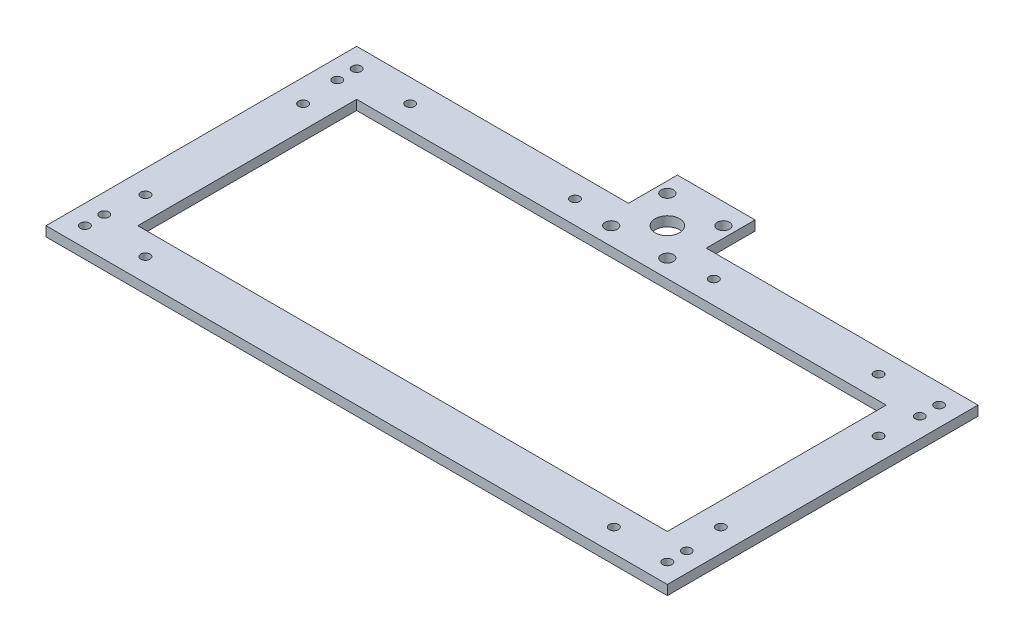
from build123d import *

# Parameters (mm, degrees)
SKETCH1_R           = 1.5
BOSS_EXTRUDE1_DEPTH = 3.175
SKETCH2_R           = 4
SKETCH2_R_2         = 2
CUT_EXTRUDE1_DEPTH  = 3.175
SKETCH3_R           = 1.5
CUT_EXTRUDE2_DEPTH  = 10


with BuildPart() as part:
    # Sketch1 → Boss-Extrude1 (new body)
    with BuildSketch(Plane(origin=(0, 0, 0), x_dir=(1, 0, 0), z_dir=(0, 1, 0))):
        Polygon((88.9, 101.6), (6.35, 101.6), (0, 101.6), (0, 0), (203.2, 0), (203.2, 101.6), (114.3, 101.6), (114.3, 117.6), (88.9, 117.6), align=None)
        with Locations((6.35, 6.35)):
            Circle(SKETCH1_R, mode=Mode.SUBTRACT)
        with Locations((6.35, 12.7)):
            Circle(SKETCH1_R, mode=Mode.SUBTRACT)
        Polygon((15, 50.8), (15, 86.6), (188.2, 86.6), (188.2, 15), (101.6, 15), (15, 15), align=None, mode=Mode.SUBTRACT)
        with Locations((6.35, 88.9)):
            Circle(SKETCH1_R, mode=Mode.SUBTRACT)
        with BuildLine():
            ThreePointArc((6.35, 93.75), (4.85, 95.25), (6.35, 96.75))
            ThreePointArc((6.35, 96.75), (7.85, 95.25), (6.35, 93.75))
        make_face(mode=Mode.SUBTRACT)
        with Locations((196.85, 6.35)):
            Circle(SKETCH1_R, mode=Mode.SUBTRACT)
        with Locations((196.85, 12.7)):
            Circle(SKETCH1_R, mode=Mode.SUBTRACT)
        with Locations((196.85, 88.9)):
            Circle(SKETCH1_R, mode=Mode.SUBTRACT)
        with Locations((196.85, 95.25)):
            Circle(SKETCH1_R, mode=Mode.SUBTRACT)
    extrude(amount=BOSS_EXTRUDE1_DEPTH)

    # Sketch2 → Cut-Extrude1 (cut)
    with BuildSketch(Plane(origin=(0, 3.175, 0), x_dir=(1, 0, 0), z_dir=(0, 1, 0))):
        with Locations((101.6, 101.6)):
            Circle(SKETCH2_R)
        with Locations((92.423098296, 110.776901704)):
            Circle(SKETCH2_R_2)
        with Locations((92.423098296, 92.423098296)):
            Circle(SKETCH2_R_2)
        with Locations((110.776901704, 110.776901704)):
            Circle(SKETCH2_R_2)
        with Locations((110.776901704, 92.423098296)):
            Circle(SKETCH2_R_2)
    extrude(amount=-CUT_EXTRUDE1_DEPTH, mode=Mode.SUBTRACT)

    # Sketch3 → Cut-Extrude2 (cut)
    with BuildSketch(Plane(origin=(0, 3.175, 0), x_dir=(1, 0, 0), z_dir=(0, 1, 0))):
        with Locations((178.2, 94.1)):
            Circle(SKETCH3_R)
        with Locations((25, 94.1)):
            Circle(SKETCH3_R)
        with Locations((78.9, 94.1)):
            Circle(SKETCH3_R)
        with Locations((124.3, 94.1)):
            Circle(SKETCH3_R)
        with Locations((178.2, 7.5)):
            Circle(SKETCH3_R)
        with Locations((25, 7.5)):
            Circle(SKETCH3_R)
        with Locations((195.7, 76.6)):
            Circle(SKETCH3_R)
        with Locations((195.7, 25)):
            Circle(SKETCH3_R)
        with Locations((7.5, 76.6)):
            Circle(SKETCH3_R)
        with Locations((7.5, 25)):
            Circle(SKETCH3_R)
    extrude(amount=-CUT_EXTRUDE2_DEPTH, mode=Mode.SUBTRACT)


solid = part.part
